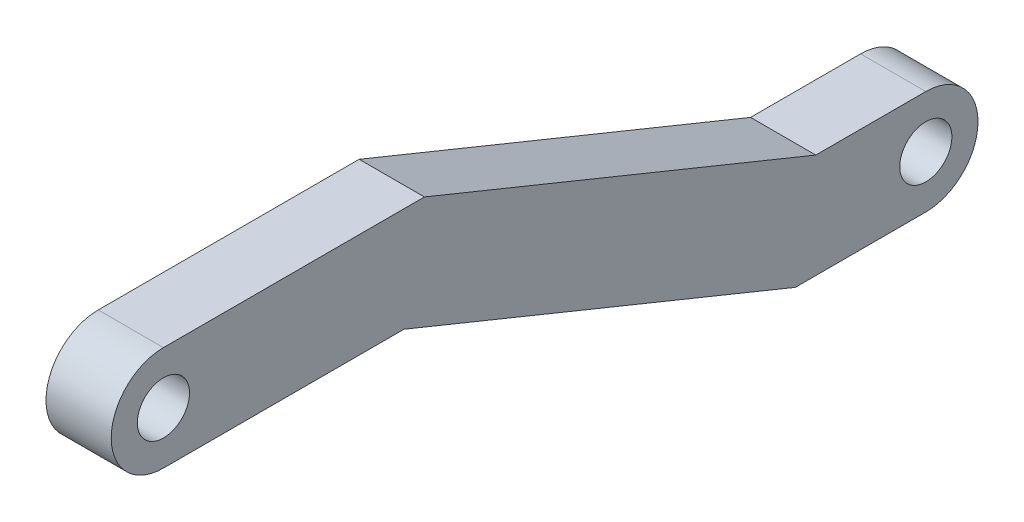
from build123d import *

# Parameters (mm, degrees)
SKETCH2_R           = 1
BOSS_EXTRUDE1_DEPTH = 2.5


with BuildPart() as part:
    # Sketch2 → Boss-Extrude1 (new body)
    with BuildSketch(Plane(origin=(0, 0, 0), x_dir=(0, 0, -1), z_dir=(1, 0, 0))):
        with BuildLine():
            Line((15, -6.109306765), (19.216665357, -6.109306765))
            ThreePointArc((19.216665357, -6.109306765), (21.216665357, -8.109306765), (19.216665357, -10.109306765))
            Line((19.216665357, -10.109306765), (14.216665357, -10.109306765))
            Line((14.216665357, -10.109306765), (-0.783334643, -4))
            Line((-0.783334643, -4), (-10.001460368, -4))
            ThreePointArc((-10.001460368, -4), (-12.001460368, -2), (-10.001460368, 0))
            Line((-10.001460368, 0), (0, 0))
            Line((0, 0), (15, -6.109306765))
        make_face()
        with Locations((-10.001460368, -2)):
            Circle(SKETCH2_R, mode=Mode.SUBTRACT)
        with Locations((19.216665357, -8.109306765)):
            Circle(SKETCH2_R, mode=Mode.SUBTRACT)
    extrude(amount=BOSS_EXTRUDE1_DEPTH)


solid = part.part
